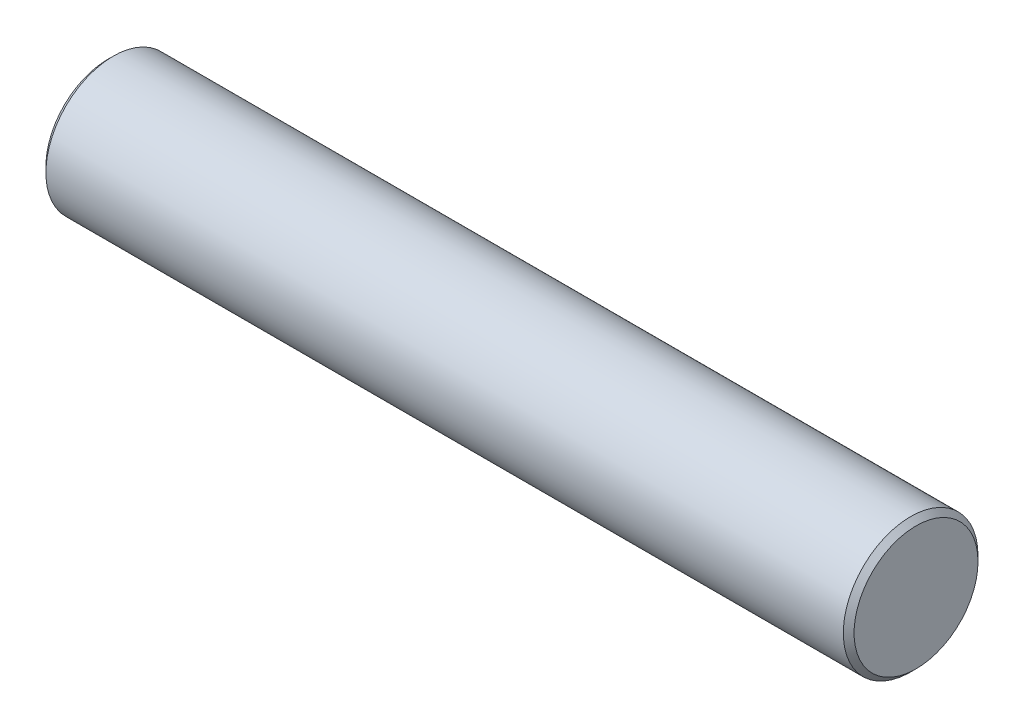
from build123d import *

# Parameters (mm, degrees)
SKETCH2_W     = 30
SKETCH2_H     = 2.5
CHAMFER2_SIZE = 0.2


with BuildPart() as part:
    # Sketch2 → Revolve1 (revolve)
    with BuildSketch(Plane.XY):
        with Locations((-15, 1.25)):
            Rectangle(SKETCH2_W, SKETCH2_H)
    revolve(axis=Axis((0, 0, 0), (-1, 0, 0)))

    # Chamfer2
    chamfer2_edges = [part.edges().sort_by_distance(p)[0] for p in [
        (-30, -2.5, 0),
        (0, -2.5, 0),
    ]]
    chamfer(chamfer2_edges, length=CHAMFER2_SIZE)


solid = part.part
